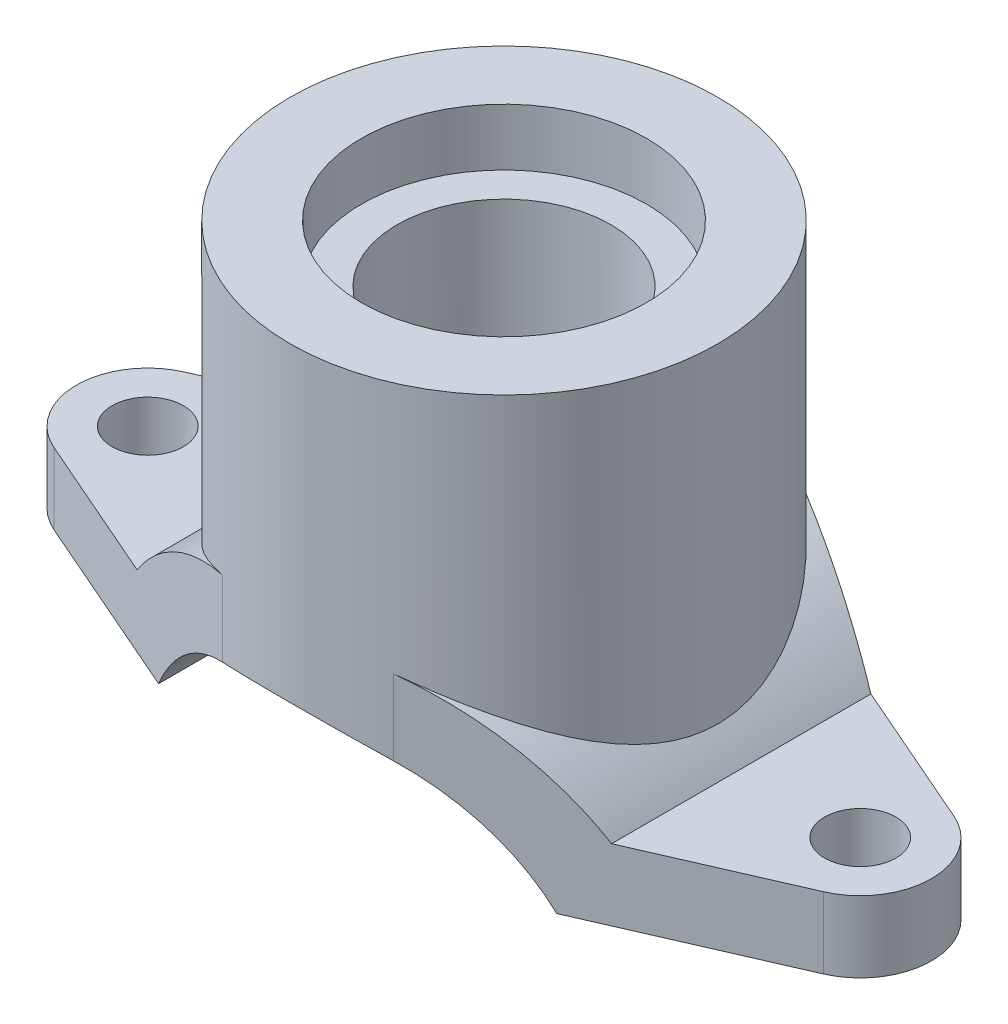
from build123d import *

# Parameters (mm, degrees)
BOSS_EXTRUDE1_DEPTH      = 75
SKETCH2_OUTSIDE_W        = 370.368
SKETCH2_OUTSIDE_H        = 220.368
CUT_EXTRUDE1_DEPTH       = 181.224859551
SKETCH2_3_R              = 12.5
CUT_EXTRUDE2_DEPTH       = 181.224859629
BOSS_EXTRUDE2_REACH      = 227
BOSS_EXTRUDE2_END_RADIUS = 105
SKETCH3_R                = 75


with BuildPart() as part:
    # Sketch1 → Boss-Extrude1 (new, symmetric)
    with BuildSketch(Plane.XY):
        with BuildLine():
            Line((-150, 0), (-69.84983894, 0))
            ThreePointArc((-69.84983894, 0), (0, 41), (69.84983894, 0))
            Line((69.84983894, 0), (150, 0))
            Line((150, 0), (150, 25))
            Line((150, 25), (83.240615087, 25))
            ThreePointArc((83.240615087, 25), (0, 66), (-83.240615087, 25))
            Line((-83.240615087, 25), (-150, 25))
            Line((-150, 25), (-150, 0))
        make_face()
    extrude(amount=BOSS_EXTRUDE1_DEPTH, both=True)

    # Sketch2 outside → Cut-Extrude1 (cut, through all)
    with BuildSketch(Plane(origin=(0, 0, 0), x_dir=(1, 0, 0), z_dir=(0, 1, 0))):
        Rectangle(SKETCH2_OUTSIDE_W, SKETCH2_OUTSIDE_H)
        with BuildLine():
            ThreePointArc((-30, -68.738635424), (-15.323223277, -73.41797347), (0, -75))
            ThreePointArc((0, -75), (15.323223277, -73.41797347), (30, -68.738635424))
            Line((30, -68.738635424), (135, -22.912878475))
            ThreePointArc((135, -22.912878475), (150, 0), (135, 22.912878475))
            Line((135, 22.912878475), (30, 68.738635424))
            ThreePointArc((30, 68.738635424), (0, 75), (-30, 68.738635424))
            Line((-30, 68.738635424), (-135, 22.912878475))
            ThreePointArc((-135, 22.912878475), (-150, 0), (-135, -22.912878475))
            Line((-135, -22.912878475), (-30, -68.738635424))
        make_face(mode=Mode.SUBTRACT)
    extrude(amount=CUT_EXTRUDE1_DEPTH, mode=Mode.SUBTRACT)

    # Sketch2<3> → Cut-Extrude2 (cut, through all)
    with BuildSketch(Plane(origin=(0, 0, 0), x_dir=(1, 0, 0), z_dir=(0, 1, 0))):
        with Locations((125, 0)):
            Circle(SKETCH2_3_R)
        with Locations((-125, 0)):
            Circle(SKETCH2_3_R)
    extrude(amount=CUT_EXTRUDE2_DEPTH, mode=Mode.SUBTRACT)

    # Boss-Extrude2: up to this cylinder (the profile starts outside it)
    boss_extrude2_end = Plane(origin=(0, -39, 0), z_dir=(0, 0, -1)) * Cylinder(BOSS_EXTRUDE2_END_RADIUS, 665, mode=Mode.PRIVATE)
    # Sketch3 → Boss-Extrude2 (add, up to the surface)
    with BuildSketch(Plane(origin=(0, 150, 0), x_dir=(1, 0, 0), z_dir=(0, 1, 0)), mode=Mode.PRIVATE) as boss_extrude2_sk1:
        Circle(SKETCH3_R)
    boss_extrude2_tool1 = extrude(boss_extrude2_sk1.sketch, amount=-BOSS_EXTRUDE2_REACH, mode=Mode.PRIVATE) - boss_extrude2_end
    add(boss_extrude2_tool1.solids().sort_by_distance((0, 150, 0))[0])

    # Sketch4 → Cut-Revolve1 (revolve, cut)
    with BuildSketch(Plane.XY):
        Polygon((0, 150), (50, 150), (50, 130), (37.5, 130), (37.5, 25.313322358), (0, 25.313322358), align=None)
    revolve(axis=Axis((0, 0, 0), (0, 1, 0)), mode=Mode.SUBTRACT)


solid = part.part
